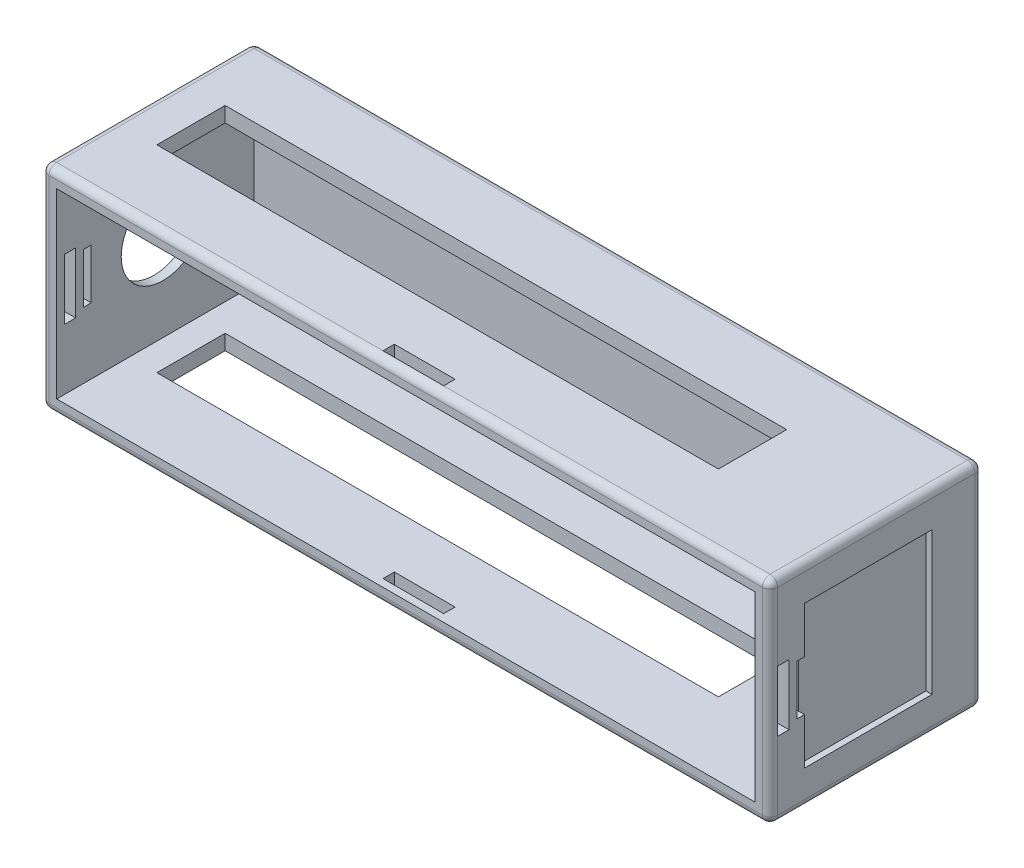
from build123d import *

# Parameters (mm, degrees)
SKETCH3_W               = 48
SKETCH3_H               = 14
BOSS_EXTRUDE2_DEPTH     = 14
SKETCH4_W               = 46
SKETCH4_H               = 12
CUT_EXTRUDE1_DEPTH      = 13
FILLET1_R               = 0.5
CUT_EXTRUDE2_DEPTH      = 32.112698372
CUT_EXTRUDE2_DEPTH_BACK = 32.112698372
SKETCH6_W               = 37
SKETCH6_H               = 4.5
SKETCH14_W              = 4
SKETCH14_H              = 1
CUT_EXTRUDE8_DEPTH      = 1.25
SKETCH15_W              = 1
SKETCH15_H              = 4
CUT_EXTRUDE9_DEPTH      = 1.25
CUT_EXTRUDE10_DEPTH     = 29.178005607
SKETCH20_W              = 1.2
SKETCH20_H              = 11
BOSS_EXTRUDE3_DEPTH     = 3
FILLET2_R               = 0.5
FILLET2_OF_MIRROR4_R    = 0.5
SKETCH24_R              = 2.75
CUT_EXTRUDE14_DEPTH     = 1
SKETCH25_W              = 0.6
SKETCH25_H              = 12
BOSS_EXTRUDE4_DEPTH     = 2.3
SKETCH28_W              = 8.4
SKETCH28_H              = 9.4
CUT_EXTRUDE15_DEPTH     = 0.4
SKETCH30_W              = 0.7
SKETCH30_H              = 12
BOSS_EXTRUDE6_DEPTH     = 11.75
CUT_EXTRUDE22_REACH     = 52.488
SKETCH38_W              = 0.5
SKETCH38_H              = 3.3
SKETCH39_W              = 0.6
SKETCH39_H              = 1.25
BOSS_EXTRUDE7_DEPTH     = 8.7
FILLET5_R               = 5
MIRROR5_START           = 3.325
MIRROR5_OUTLINE_W       = 0.4
MIRROR5_OUTLINE_H       = 9.4
MIRROR5_DEPTH           = 8.4
MIRROR5_START_2         = 11.725
MIRROR5_2_OUTLINE_W     = 1
MIRROR5_2_OUTLINE_H     = 3.3
MIRROR5_2_OUTLINE_W_2   = 0.7
MIRROR5_2_DEPTH         = 0.5
SKETCH36_W              = 0.7
SKETCH36_H              = 12
CUT_EXTRUDE23_DEPTH     = 11.75
SKETCH40_W              = 1.8
SKETCH40_H              = 12
CUT_EXTRUDE24_DEPTH     = 11
BOSS_EXTRUDE8_START     = 4
BOSS_EXTRUDE8_DEPTH     = 4
BOSS_EXTRUDE9_DEPTH     = 4


# Read off the part's stored shape, not the designer's step: Mirror5
with BuildPart() as part:
    # Sketch3 → Boss-Extrude2 (new body)
    with BuildSketch(Plane.XY):
        Rectangle(SKETCH3_W, SKETCH3_H)
    extrude(amount=BOSS_EXTRUDE2_DEPTH)

    # Sketch4 → Cut-Extrude1 (cut)
    with BuildSketch(Plane.XY.offset(14)):
        Rectangle(SKETCH4_W, SKETCH4_H)
    extrude(amount=-CUT_EXTRUDE1_DEPTH, mode=Mode.SUBTRACT)

    # Fillet1
    fillet1_edges = [part.edges().sort_by_distance(p)[0] for p in [
        (-24, 0, 14),
        (0, -7, 14),
        (24, 0, 14),
        (0, -7, 0),
        (-24, 0, 0),
        (0, 7, 0),
        (24, 0, 0),
        (24, -7, 7),
        (-24, -7, 7),
        (-24, 7, 7),
        (24, 7, 7),
        (0, 7, 14),
    ]]
    fillet(fillet1_edges, radius=FILLET1_R)

    # Sketch6 → Cut-Extrude2 (cut, two sides: drawn at the far end of the back side and taken through both)
    with BuildSketch(Plane.XZ.offset(7).offset(-CUT_EXTRUDE2_DEPTH_BACK)):
        with Locations((-2.7, 6.95)):
            Rectangle(SKETCH6_W, SKETCH6_H)
    extrude(amount=CUT_EXTRUDE2_DEPTH + CUT_EXTRUDE2_DEPTH_BACK, mode=Mode.SUBTRACT)

    # Sketch14 → Cut-Extrude8 (cut)
    with BuildSketch(Plane.XY.offset(14)):
        with Locations((0, 6.5)):
            Rectangle(SKETCH14_W, SKETCH14_H)
    cut_extrude8 = extrude(amount=-CUT_EXTRUDE8_DEPTH, mode=Mode.SUBTRACT)

    # Mirror1: Cut-Extrude8 across plane
    add(cut_extrude8.mirror(Plane(origin=(0, 0, 0), x_dir=(0, 0, 1), z_dir=(0, -1, 0))), mode=Mode.SUBTRACT)

    # Sketch15 → Cut-Extrude9 (cut)
    with BuildSketch(Plane.XY.offset(14)):
        with Locations((23.5, 0)):
            Rectangle(SKETCH15_W, SKETCH15_H)
    cut_extrude9 = extrude(amount=-CUT_EXTRUDE9_DEPTH, mode=Mode.SUBTRACT)

    # Mirror3: Cut-Extrude9 across plane
    add(cut_extrude9.mirror(Plane.ZY), mode=Mode.SUBTRACT)

    # Sketch17 → Cut-Extrude10 (cut, through all)
    with BuildSketch(Plane.XY.offset(1)):
        with BuildLine():
            Line((20, 4.675), (19.45, 4.675))
            ThreePointArc((19.45, 4.675), (18.389339828, 4.235660172), (17.95, 3.175))
            Line((17.95, 3.175), (17.95, -3.175))
            ThreePointArc((17.95, -3.175), (18.389339828, -4.235660172), (19.45, -4.675))
            Line((19.45, -4.675), (20, -4.675))
            ThreePointArc((20, -4.675), (21.060660172, -4.235660172), (21.5, -3.175))
            Line((21.5, -3.175), (21.5, 3.175))
            ThreePointArc((21.5, 3.175), (21.060660172, 4.235660172), (20, 4.675))
        make_face()
    extrude(amount=-CUT_EXTRUDE10_DEPTH, mode=Mode.SUBTRACT)

    # Sketch20 → Boss-Extrude3 (add)
    with BuildSketch(Plane(origin=(0, -6, 0), x_dir=(1, 0, 0), z_dir=(0, 1, 0))):
        with Locations((-21.8, -6.5)):
            Rectangle(SKETCH20_W, SKETCH20_H)
    boss_extrude3 = extrude(amount=BOSS_EXTRUDE3_DEPTH)

    # Fillet2
    fillet2_edges = [part.edges().sort_by_distance(p)[0] for p in [
        (-21.2, -3, 6.5),
        (-22.4, -3, 6.5),
    ]]
    fillet(fillet2_edges, radius=FILLET2_R)

    # Mirror4: Boss-Extrude3 across plane
    add(boss_extrude3.mirror(Plane(origin=(0, 0, 0), x_dir=(0, 0, 1), z_dir=(0, -1, 0))))

    # Fillet2 of Mirror4
    fillet2_of_mirror4_edges = [part.edges().sort_by_distance(p)[0] for p in [
        (-21.2, 3, 6.5),
        (-22.4, 3, 6.5),
    ]]
    fillet(fillet2_of_mirror4_edges, radius=FILLET2_OF_MIRROR4_R)

    # Sketch24 → Cut-Extrude14 (cut)
    with BuildSketch(Plane.ZY.offset(24)):
        with Locations((7, 0)):
            Circle(SKETCH24_R)
    extrude(amount=-CUT_EXTRUDE14_DEPTH, mode=Mode.SUBTRACT)

    # Sketch25 → Boss-Extrude4 (add)
    with BuildSketch(Plane.XY.offset(1)):
        with Locations((-22.7, 0)):
            Rectangle(SKETCH25_W, SKETCH25_H)
    extrude(amount=BOSS_EXTRUDE4_DEPTH)

    # Sketch28 → Cut-Extrude15 (cut)
    with BuildSketch(Plane(origin=(24, 0, 0), x_dir=(0, 0, -1), z_dir=(1, 0, 0))):
        with Locations((-7.525, 0)):
            Rectangle(SKETCH28_W, SKETCH28_H)
    extrude(amount=-CUT_EXTRUDE15_DEPTH, mode=Mode.SUBTRACT)

    # Sketch30 → Boss-Extrude6 (add)
    with BuildSketch(Plane.XY.offset(1)):
        with Locations((22.65, 0)):
            Rectangle(SKETCH30_W, SKETCH30_H)
    extrude(amount=BOSS_EXTRUDE6_DEPTH)

    # Cut-Extrude22: up to this face of the body (flat: up to its plane)
    cut_extrude22_end = Plane(part.part.faces().sort_by_distance((23, 4, 13.375))[0])
    # Sketch38 → Cut-Extrude22 (cut, up to the picked face)
    with BuildSketch(Plane(origin=(24, 0, 0), x_dir=(0, 0, -1), z_dir=(1, 0, 0)), mode=Mode.PRIVATE) as cut_extrude22_sk1:
        with Locations((-11.975, 0)):
            Rectangle(SKETCH38_W, SKETCH38_H)
    cut_extrude22_tool1 = split(extrude(cut_extrude22_sk1.sketch, amount=-CUT_EXTRUDE22_REACH, mode=Mode.PRIVATE), bisect_by=cut_extrude22_end, keep=Keep.BOTH, mode=Mode.PRIVATE)
    add(cut_extrude22_tool1.solids().sort_by(Axis((24, 0, 11.975), (-1, 0, 0)))[0], mode=Mode.SUBTRACT)

    # Sketch39 → Boss-Extrude7 (add)
    with BuildSketch(Plane.XY.offset(3.3)):
        with Locations((-22.7, 5.375)):
            Rectangle(SKETCH39_W, SKETCH39_H)
        with Locations((-22.7, -5.375)):
            Rectangle(SKETCH39_W, SKETCH39_H)
    extrude(amount=BOSS_EXTRUDE7_DEPTH)

    # Fillet5
    # the kernel refuses this fillet: 5 mm, written as the material it takes off along each edge
    with BuildSketch(Plane(origin=(-23, 4.75, 12), x_dir=(0, 1, 0), z_dir=(1, 0, 0))) as fillet5_piece_1:
        with BuildLine():
            CenterArc((5, -3.307189139), FILLET5_R, 138.590377891, 41.409622109)
            Line((0, -3.307189139), (0, 0))
            Line((0, 0), (1.25, 0))
        make_face()
    extrude(amount=0.6, mode=Mode.SUBTRACT)
    with BuildSketch(Plane(origin=(-23, -4.75, 12), x_dir=(0, 0, -1), z_dir=(1, 0, 0))) as fillet5_piece_2:
        with BuildLine():
            CenterArc((3.307189139, -5), FILLET5_R, 90, 41.409622109)
            Line((0, -1.25), (0, 0))
            Line((0, 0), (3.307189139, 0))
        make_face()
    extrude(amount=0.6, mode=Mode.SUBTRACT)

    # Mirror5 outline → Mirror5 (cut)
    with BuildSketch(Plane.XY.offset(MIRROR5_START)):
        with Locations((-23.8, 0)):
            Rectangle(MIRROR5_OUTLINE_W, MIRROR5_OUTLINE_H)
    extrude(amount=MIRROR5_DEPTH, mode=Mode.SUBTRACT)

    # Mirror5 2 outline → Mirror5 2 (cut)
    with BuildSketch(Plane.XY.offset(MIRROR5_START_2)):
        with Locations((-23.5, 0)):
            Rectangle(MIRROR5_2_OUTLINE_W, MIRROR5_2_OUTLINE_H)
        with Locations((22.65, 0)):
            Rectangle(MIRROR5_2_OUTLINE_W_2, MIRROR5_2_OUTLINE_H)
    extrude(amount=MIRROR5_2_DEPTH, mode=Mode.SUBTRACT)

    # Sketch36 → Cut-Extrude23 (cut)
    with BuildSketch(Plane.XY.offset(12.75)):
        with Locations((22.65, 0)):
            Rectangle(SKETCH36_W, SKETCH36_H)
    extrude(amount=-CUT_EXTRUDE23_DEPTH, mode=Mode.SUBTRACT)

    # Sketch40 → Cut-Extrude24 (cut)
    with BuildSketch(Plane.XY.offset(12)):
        with Locations((-22.1, 0)):
            Rectangle(SKETCH40_W, SKETCH40_H)
    extrude(amount=-CUT_EXTRUDE24_DEPTH, mode=Mode.SUBTRACT)

    # Sketch41 → Boss-Extrude8 (add)
    with BuildSketch(Plane(origin=(0, -2, 0), x_dir=(1, 0, 0), z_dir=(0, 1, 0)).offset(BOSS_EXTRUDE8_START)):
        with BuildLine():
            Line((24, -13.5), (23, -13.5))
            Line((23, -13.5), (23, -14))
            Line((23, -14), (23.5, -14))
            ThreePointArc((23.5, -14), (23.853553391, -13.853553391), (24, -13.5))
        make_face()
    boss_extrude8 = extrude(amount=-BOSS_EXTRUDE8_DEPTH)

    # Mirror6: Boss-Extrude8 across plane
    add(boss_extrude8.mirror(Plane.ZY))

    # Sketch42 → Boss-Extrude9 (add)
    with BuildSketch(Plane.ZY.offset(-2)):
        with BuildLine():
            Line((14, -6), (14, -6.5))
            ThreePointArc((14, -6.5), (13.853553391, -6.853553391), (13.5, -7))
            Line((13.5, -7), (13.5, -6))
            Line((13.5, -6), (14, -6))
        make_face()
    boss_extrude9 = extrude(amount=BOSS_EXTRUDE9_DEPTH)

    # Mirror7: Boss-Extrude9 across plane
    add(boss_extrude9.mirror(Plane(origin=(0, 0, 0), x_dir=(0, 0, 1), z_dir=(0, -1, 0))))


solid = part.part
